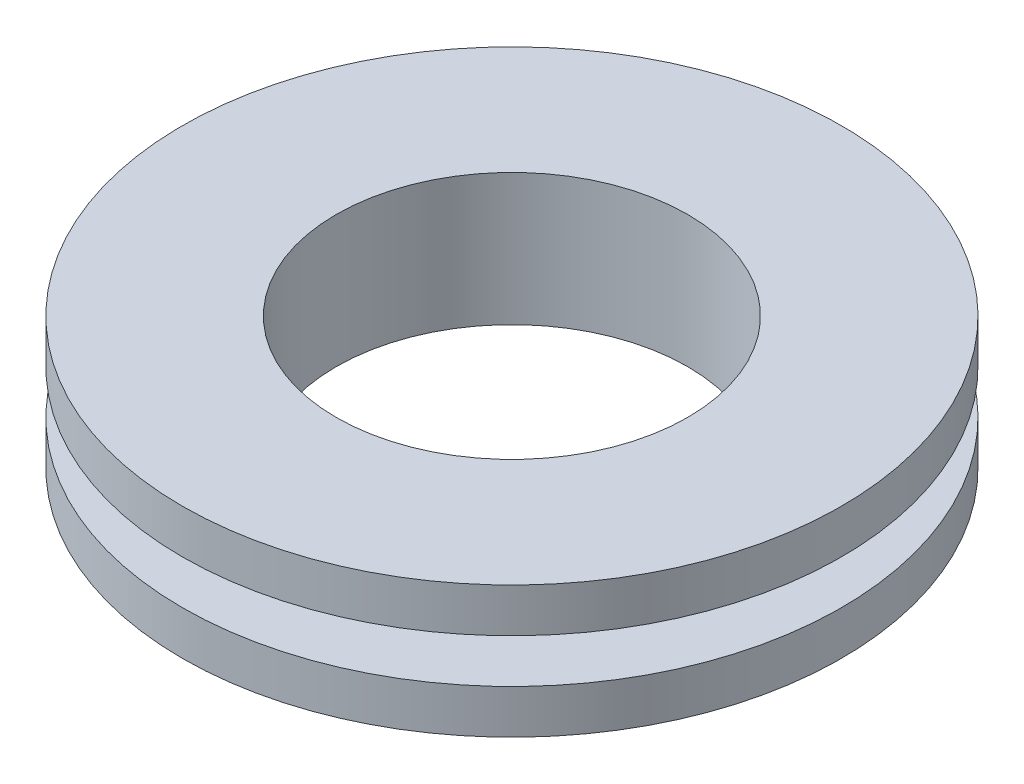
from build123d import *


with BuildPart() as part:
    # Sketch1 → Revolve1 (revolve)
    with BuildSketch(Plane.XY):
        Polygon((4, 1.5), (4, -1.5), (7.5, -1.5), (7.5, -0.5), (6, -0.5), (6, 0.5), (7.5, 0.5), (7.5, 1.5), align=None)
    revolve(axis=Axis((0, 5.870558795, 0), (0, -1, 0)))


solid = part.part
